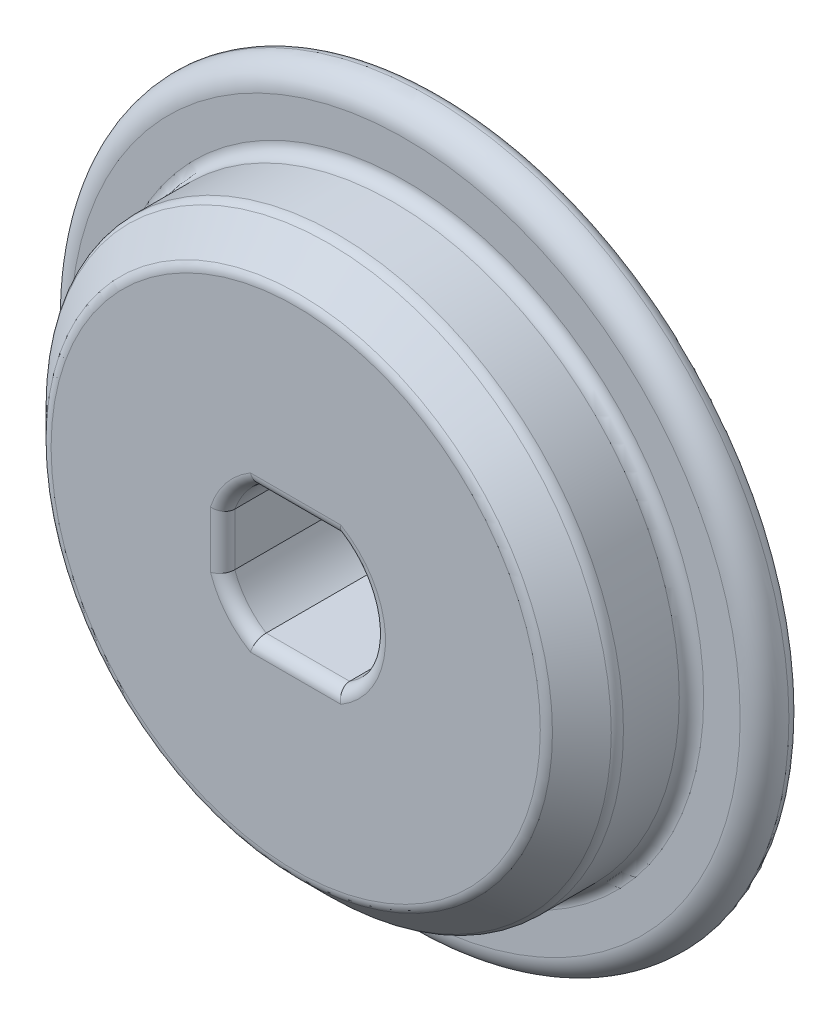
from build123d import *

# Parameters (mm, degrees)
SKETCH1_R           = 29.5
BOSS_EXTRUDE1_DEPTH = 3
SKETCH2_R           = 23.5
BOSS_EXTRUDE2_DEPTH = 9
CUT_EXTRUDE1_DEPTH  = 44.410828142
FILLET1_R           = 2
CHAMFER1_SIZE       = 3
FILLET2_R           = 1
FILLET3_R           = 1


with BuildPart() as part:
    # Sketch1 → Boss-Extrude1 (new body)
    with BuildSketch(Plane.XY):
        Circle(SKETCH1_R)
    extrude(amount=BOSS_EXTRUDE1_DEPTH)

    # Sketch2 → Boss-Extrude2 (add)
    with BuildSketch(Plane.XY.offset(3)):
        Circle(SKETCH2_R)
    extrude(amount=BOSS_EXTRUDE2_DEPTH)

    # Sketch3 → Cut-Extrude1 (cut, through all)
    with BuildSketch(Plane.XY.offset(12)):
        with BuildLine():
            ThreePointArc((6.375, 0), (5.589857961, 3.064981726), (3.4278273, 5.375))
            Line((3.4278273, 5.375), (-3.4278273, 5.375))
            ThreePointArc((-3.4278273, 5.375), (-4.981400642, 3.97822481), (-6, 2.154210992))
            Line((-6, 2.154210992), (-6, -2.154210992))
            ThreePointArc((-6, -2.154210992), (-4.981400642, -3.97822481), (-3.4278273, -5.375))
            Line((-3.4278273, -5.375), (3.4278273, -5.375))
            ThreePointArc((3.4278273, -5.375), (5.589857961, -3.064981726), (6.375, 0))
        make_face()
    extrude(amount=-CUT_EXTRUDE1_DEPTH, mode=Mode.SUBTRACT)

    # Fillet1
    fillet1_edges = [part.edges().sort_by_distance(p)[0] for p in [
        (-29.5, 0, 3),
    ]]
    fillet(fillet1_edges, radius=FILLET1_R)

    # Chamfer1
    chamfer1_edges = [part.edges().sort_by_distance(p)[0] for p in [
        (-23.5, 0, 12),
    ]]
    chamfer(chamfer1_edges, length=CHAMFER1_SIZE)

    # Fillet2
    fillet2_edges = [part.edges().sort_by_distance(p)[0] for p in [
        (0, 5.375, 0),
        (6.375, 0, 0),
        (0, -5.375, 12),
        (-4.981400642, -3.97822481, 0),
        (-6, 0, 0),
        (-4.981400642, 3.97822481, 0),
        (0, -5.375, 0),
        (0, 5.375, 12),
        (-29.5, 0, 0),
        (-4.981400642, 3.97822481, 12),
        (-6, 0, 12),
        (-4.981400642, -3.97822481, 12),
        (6.375, 0, 12),
        (-20.5, 0, 12),
        (-23.5, 0, 9),
    ]]
    fillet(fillet2_edges, radius=FILLET2_R - 0.0001)  # a hair under: the kernel refuses the full size

    # Fillet3
    fillet3_edges = [part.edges().sort_by_distance(p)[0] for p in [
        (-23.5, 0, 3),
    ]]
    fillet(fillet3_edges, radius=FILLET3_R)


solid = part.part
